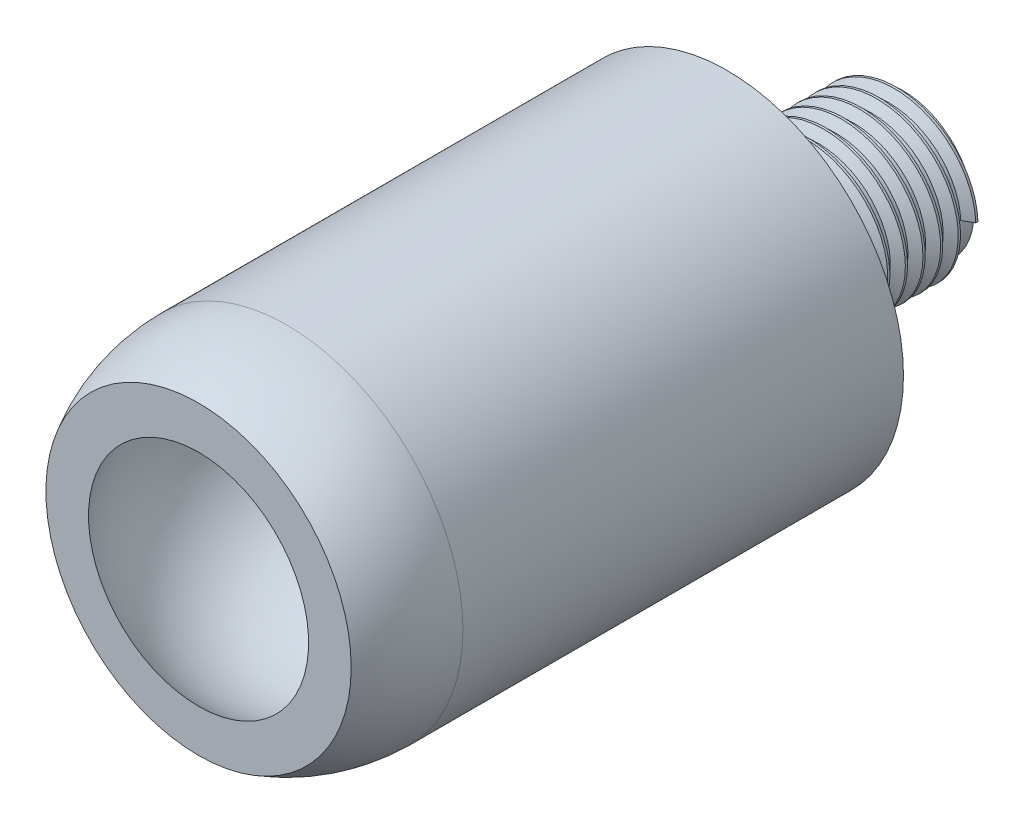
from build123d import *

# Parameters (mm, degrees)
SKETCH1_R           = 10
BOSS_EXTRUDE1_DEPTH = 25
SKETCH2_R           = 4
BOSS_EXTRUDE2_DEPTH = 10
THREAD1_PITCH       = 1


with BuildPart() as part:
    # Sketch1 → Boss-Extrude1 (new body)
    with BuildSketch(Plane.XY):
        Circle(SKETCH1_R)
    extrude(amount=BOSS_EXTRUDE1_DEPTH)

    # Sketch2 → Boss-Extrude2 (add)
    with BuildSketch(Plane(origin=(0, 0, 0), x_dir=(-1, 0, 0), z_dir=(0, 0, -1))):
        Circle(SKETCH2_R)
    extrude(amount=BOSS_EXTRUDE2_DEPTH)

    # Thread1: the profile of Thread Profile1 profile screwed along a right-hand helix of 10 turns, 8 arcs to a turn; built about Z, then put on its axis
    thread1_z = Axis((0, 0, 0), (0, 0, 1))
    thread1_corners = [(3.9997, 0, -0.000173205), (4.541265875, 0, 0.312499999), (4.541265875, 0, 0.437499999), (3.9997, 0, 0.750173202)]
    with BuildLine(mode=Mode.PRIVATE) as thread1_profile:
        Line(thread1_corners[0], thread1_corners[1])
        Line(thread1_corners[1], thread1_corners[2])
        Line(thread1_corners[2], thread1_corners[3])
        Line(thread1_corners[3], thread1_corners[0])
    thread1_cap = Face(thread1_profile.wire())
    thread1_turn_angles = [0, 22.5, 45, 67.5, 90, 112.5, 135, 157.5, 180, 202.5, 225, 247.5, 270, 292.5, 315, 337.5, 360]
    thread1_turn_weights = [1, 0.9238795325112867, 1, 0.9238795325112867, 1, 0.9238795325112867, 1, 0.9238795325112867, 1, 0.9238795325112867, 1, 0.9238795325112867, 1, 0.9238795325112867, 1, 0.9238795325112867, 1]
    thread1_turn_rails = [Edge.make_bspline([Vector(p[0], p[1], 0).rotate(thread1_z, thread1_turn_angles[k]) / thread1_turn_weights[k] + Vector(0, 0, p[2] + THREAD1_PITCH * thread1_turn_angles[k] / 360) for k in range(17)], [0, 0, 0, 1, 1, 2, 2, 3, 3, 4, 4, 5, 5, 6, 6, 7, 7, 8, 8, 8], 2, thread1_turn_weights) for p in thread1_corners]
    thread1_turn_sides = [Face.make_surface_from_curves(thread1_turn_rails[p[0]], thread1_turn_rails[p[1]]) for p in [(0, 1), (1, 2), (2, 3), (3, 0)]]
    thread1 = Plane(origin=(0, 0, -10), x_dir=(1, 0, 0), z_dir=(0, 0, 1)) * Solid(Shell([*[p.moved(Location((0, 0, THREAD1_PITCH * i))) for i in range(10) for p in thread1_turn_sides], thread1_cap, thread1_cap.rotate(thread1_z, 3600).moved(Location((0, 0, THREAD1_PITCH * 3600 / 360)))]))
    add(thread1)

    # Sketch7 → Cut-Revolve1 (revolve, cut)
    with BuildSketch(Plane(origin=(0, 0, 0), x_dir=(0, 0, -1), z_dir=(1, 0, 0))):
        with BuildLine():
            Line((-25, 10), (-25, 0))
            Line((-25, 0), (-15, 0))
            ThreePointArc((-15, 0), (-17.928932188, 7.071067812), (-25, 10))
        make_face()
    revolve(axis=Axis((0, 0, 25), (0, 0, -1)), mode=Mode.SUBTRACT)

    # Sketch8 → Revolve2 (revolve)
    with BuildSketch(Plane(origin=(0, 0, 0), x_dir=(0, 0, -1), z_dir=(1, 0, 0)), mode=Mode.PRIVATE) as revolve2_sk:
        with BuildLine():
            Line((-17, 0), (-15, 0))
            ThreePointArc((-15, 0), (-20, 8.660254038), (-30, 8.660254038))
            Line((-30, 8.660254038), (-29, 6.92820323))
            ThreePointArc((-29, 6.92820323), (-21, 6.92820323), (-17, 0))
        make_face()
        with BuildLine():
            Line((-29, 6.92820323), (-30, 8.660254038))
            Line((-30, 8.660254038), (-30, 6.244997998))
            ThreePointArc((-30, 6.244997998), (-29.512947191, 6.605551275), (-29, 6.92820323))
        make_face()
    revolve(revolve2_sk.sketch.rotate(Axis((0, 0, 25), (0, 0, -1)), 90), axis=Axis((0, 0, 25), (0, 0, -1)))


solid = part.part
